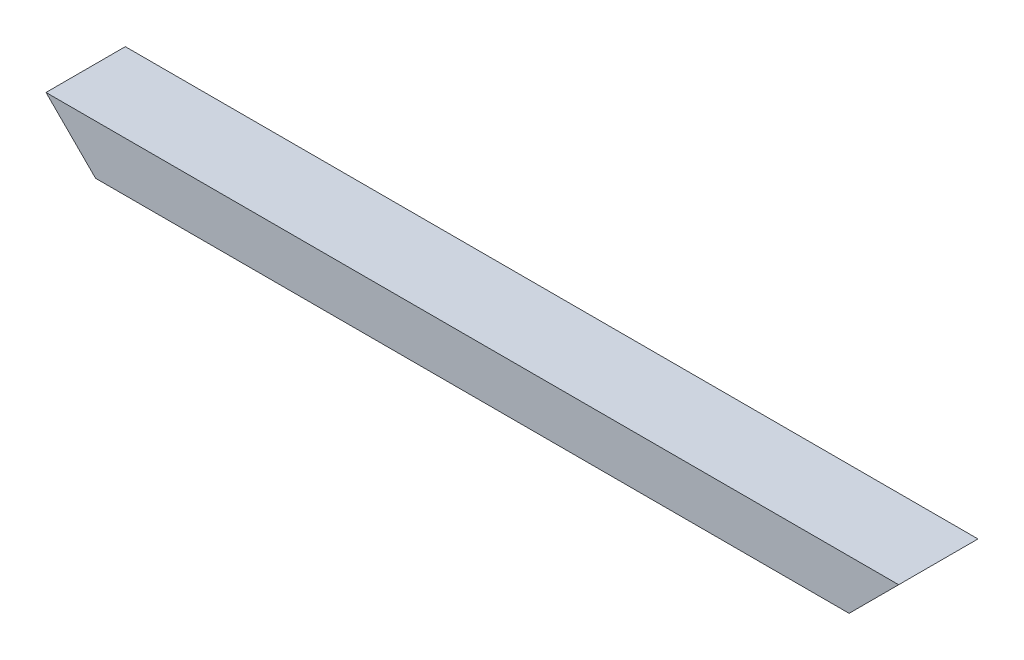
from build123d import *

# Parameters (mm, degrees)
BOSS_EXTRUDE1_DEPTH = 101.6


with BuildPart() as part:
    # Sketch2 → Boss-Extrude1 (new body)
    with BuildSketch(Plane.XY):
        Polygon((0, 0), (965.2, 0), (1028.7, 63.5), (-63.5, 63.5), align=None)
    extrude(amount=BOSS_EXTRUDE1_DEPTH)


solid = part.part
